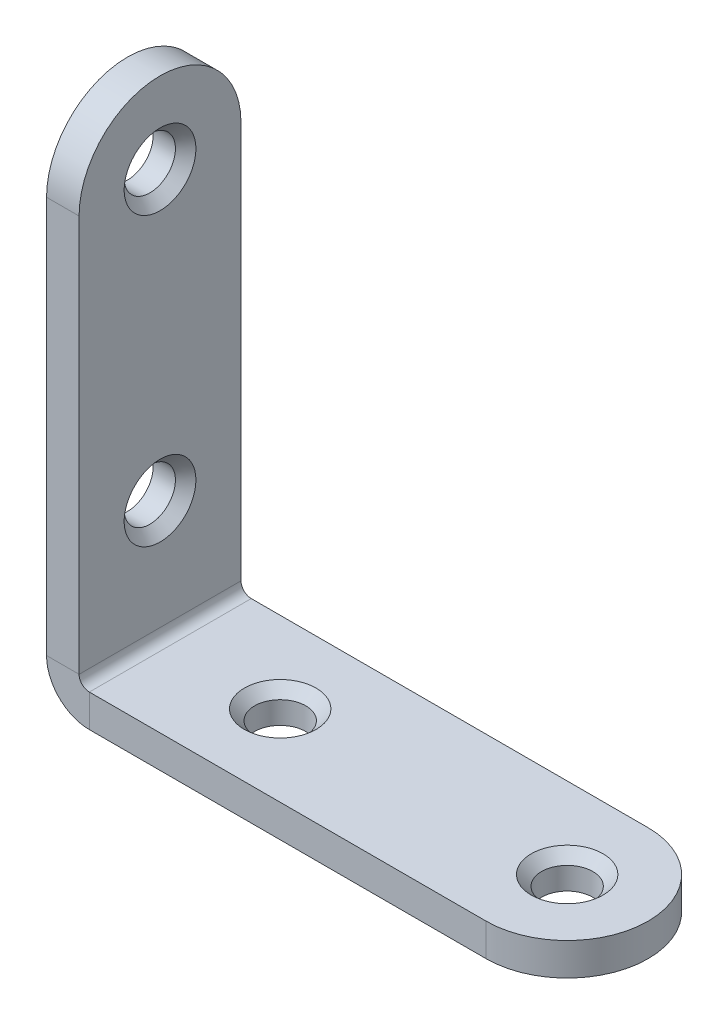
from build123d import *

# Parameters (mm, degrees)
FLANGE_BASE1_DEPTH    = 7.9
FILETE2_RADIUS        = 7.9
FILETE2_LENGTH        = 3.175
FILETE4_RADIUS        = 7.9
FILETE4_LENGTH        = 3.175
ESBO_O6_R             = 2.5
CORTE_EXTRUS_O1_DEPTH = 71.07988745
ESBO_O7_R             = 2.5
CORTE_EXTRUS_O2_DEPTH = 71.07988745
CHANFRO2_SIZE         = 1


# Sheet-metal steps are written as plain solids
with BuildPart() as part:
    # Esboço1 → Flange-base1 (new, symmetric)
    with BuildSketch(Plane.XY):
        with BuildLine():
            Line((50.8, 0), (4.175, 0))
            ThreePointArc((4.175, 0), (1.222829189, 1.222829189), (0, 4.175))
            Line((0, 4.175), (0, 50.8))
            Line((0, 50.8), (3.175, 50.8))
            Line((3.175, 50.8), (3.175, 4.175))
            ThreePointArc((3.175, 4.175), (3.467893219, 3.467893219), (4.175, 3.175))
            Line((4.175, 3.175), (50.8, 3.175))
            Line((50.8, 3.175), (50.8, 0))
        make_face()
    extrude(amount=FLANGE_BASE1_DEPTH, both=True)

    # Filete2: full round fillet: the end face becomes a half cylinder, R = half its width
    filete2_face = Plane((1.5875, 50.8, 0), x_dir=(1, 0, 0), z_dir=(0, 1, 0))  # on the end face: x along it, z out of the body
    filete2_slab = filete2_face.offset(-FILETE2_RADIUS / 2) * Box(FILETE2_LENGTH, 2 * FILETE2_RADIUS, FILETE2_RADIUS, mode=Mode.PRIVATE)  # the body's end, R deep
    filete2_round = Plane((1.5875, 42.9, 0), x_dir=(0, 1, 0), z_dir=(1, 0, 0)) * Cylinder(FILETE2_RADIUS, FILETE2_LENGTH, mode=Mode.PRIVATE)  # its axis R under the face
    add(filete2_slab - filete2_round, mode=Mode.SUBTRACT)

    # Filete4: full round fillet: the end face becomes a half cylinder, R = half its width
    filete4_face = Plane((50.8, 1.5875, 0), x_dir=(0, -1, 0), z_dir=(1, 0, 0))  # on the end face: x along it, z out of the body
    filete4_slab = filete4_face.offset(-FILETE4_RADIUS / 2) * Box(FILETE4_LENGTH, 2 * FILETE4_RADIUS, FILETE4_RADIUS, mode=Mode.PRIVATE)  # the body's end, R deep
    filete4_round = Plane((42.9, 1.5875, 0), x_dir=(1, 0, 0), z_dir=(0, -1, 0)) * Cylinder(FILETE4_RADIUS, FILETE4_LENGTH, mode=Mode.PRIVATE)  # its axis R under the face
    add(filete4_slab - filete4_round, mode=Mode.SUBTRACT)

    # Esboço6 → Corte-extrusão1 (cut, through all)
    with BuildSketch(Plane(origin=(0, 3.175, 0), x_dir=(1, 0, 0), z_dir=(0, 1, 0))):
        with Locations(Location((14.9, 0, 0), (0, 0, 270))):
            Circle(ESBO_O6_R)
        with Locations(Location((42.9, 0, 0), (0, 0, 270))):
            Circle(ESBO_O6_R)
    extrude(amount=-CORTE_EXTRUS_O1_DEPTH, mode=Mode.SUBTRACT)

    # Esboço7 → Corte-extrusão2 (cut, through all)
    with BuildSketch(Plane(origin=(3.175, 0, 0), x_dir=(0, 0, -1), z_dir=(1, 0, 0))):
        with Locations((0, 42.9)):
            Circle(ESBO_O7_R)
        with Locations((0, 14.9)):
            Circle(ESBO_O7_R)
    extrude(amount=-CORTE_EXTRUS_O2_DEPTH, mode=Mode.SUBTRACT)

    # Chanfro2
    chanfro2_edges = [part.edges().sort_by_distance(p)[0] for p in [
        (42.9, 3.175, -2.5),
        (14.9, 3.175, -2.5),
        (3.175, 42.9, 2.5),
        (3.175, 14.9, 2.5),
    ]]
    chamfer(chanfro2_edges, length=CHANFRO2_SIZE)


solid = part.part
